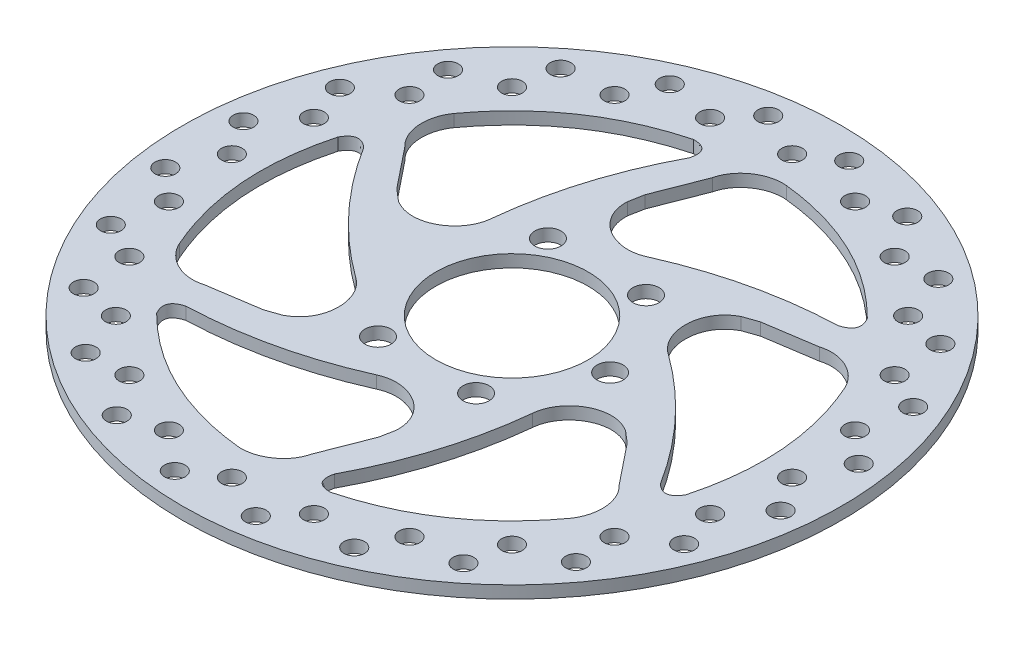
from build123d import *

# Parameters (mm, degrees)
SKETCH1_R           = 80
SKETCH1_R_2         = 2.5
SKETCH1_R_3         = 18.5
SKETCH1_R_4         = 3.175
BOSS_EXTRUDE1_DEPTH = 3


with BuildPart() as part:
    # Sketch1 → Boss-Extrude1 (new body)
    with BuildSketch(Plane(origin=(0, 0, 0), x_dir=(1, 0, 0), z_dir=(0, 1, 0))):
        Circle(SKETCH1_R)
        with Locations((0, 68)):
            Circle(SKETCH1_R_2, mode=Mode.SUBTRACT)
        with Locations((8.332202922, 73.529411765)):
            Circle(SKETCH1_R_2, mode=Mode.SUBTRACT)
        with Locations((17.599695067, 65.682956188)):
            Circle(SKETCH1_R_2, mode=Mode.SUBTRACT)
        with Locations((27.079102132, 68.867425011)):
            Circle(SKETCH1_R_2, mode=Mode.SUBTRACT)
        with Locations((34, 58.889727457)):
            Circle(SKETCH1_R_2, mode=Mode.SUBTRACT)
        with Locations((43.980605282, 59.512237052)):
            Circle(SKETCH1_R_2, mode=Mode.SUBTRACT)
        with Locations((48.083261121, 48.083261121)):
            Circle(SKETCH1_R_2, mode=Mode.SUBTRACT)
        with Locations((57.884902864, 46.101388487)):
            Circle(SKETCH1_R_2, mode=Mode.SUBTRACT)
        with Locations((58.889727457, 34)):
            Circle(SKETCH1_R_2, mode=Mode.SUBTRACT)
        with Locations((67.844439975, 29.548806482)):
            Circle(SKETCH1_R_2, mode=Mode.SUBTRACT)
        with Locations((65.682956188, 17.599695067)):
            Circle(SKETCH1_R_2, mode=Mode.SUBTRACT)
        with Locations((73.180490619, 10.982522147)):
            Circle(SKETCH1_R_2, mode=Mode.SUBTRACT)
        with Locations((68, 0)):
            Circle(SKETCH1_R_2, mode=Mode.SUBTRACT)
        with Locations((73.529411765, -8.332202922)):
            Circle(SKETCH1_R_2, mode=Mode.SUBTRACT)
        with Locations((65.682956188, -17.599695067)):
            Circle(SKETCH1_R_2, mode=Mode.SUBTRACT)
        with Locations((68.867425011, -27.079102132)):
            Circle(SKETCH1_R_2, mode=Mode.SUBTRACT)
        with Locations((58.889727457, -34)):
            Circle(SKETCH1_R_2, mode=Mode.SUBTRACT)
        with Locations((59.512237052, -43.980605282)):
            Circle(SKETCH1_R_2, mode=Mode.SUBTRACT)
        with Locations((48.083261121, -48.083261121)):
            Circle(SKETCH1_R_2, mode=Mode.SUBTRACT)
        with Locations((46.101388487, -57.884902864)):
            Circle(SKETCH1_R_2, mode=Mode.SUBTRACT)
        with Locations((34, -58.889727457)):
            Circle(SKETCH1_R_2, mode=Mode.SUBTRACT)
        with Locations((29.548806482, -67.844439975)):
            Circle(SKETCH1_R_2, mode=Mode.SUBTRACT)
        with Locations((17.599695067, -65.682956188)):
            Circle(SKETCH1_R_2, mode=Mode.SUBTRACT)
        with Locations((10.982522147, -73.180490619)):
            Circle(SKETCH1_R_2, mode=Mode.SUBTRACT)
        with Locations((0, -68)):
            Circle(SKETCH1_R_2, mode=Mode.SUBTRACT)
        with Locations((-8.332202922, -73.529411765)):
            Circle(SKETCH1_R_2, mode=Mode.SUBTRACT)
        with Locations((-17.599695067, -65.682956188)):
            Circle(SKETCH1_R_2, mode=Mode.SUBTRACT)
        with Locations((-27.079102132, -68.867425011)):
            Circle(SKETCH1_R_2, mode=Mode.SUBTRACT)
        with Locations((-34, -58.889727457)):
            Circle(SKETCH1_R_2, mode=Mode.SUBTRACT)
        with Locations((-43.980605282, -59.512237052)):
            Circle(SKETCH1_R_2, mode=Mode.SUBTRACT)
        with Locations((-48.083261121, -48.083261121)):
            Circle(SKETCH1_R_2, mode=Mode.SUBTRACT)
        with Locations((-57.884902864, -46.101388487)):
            Circle(SKETCH1_R_2, mode=Mode.SUBTRACT)
        with Locations((-58.889727457, -34)):
            Circle(SKETCH1_R_2, mode=Mode.SUBTRACT)
        with Locations((-67.844439975, -29.548806482)):
            Circle(SKETCH1_R_2, mode=Mode.SUBTRACT)
        with Locations((-65.682956188, -17.599695067)):
            Circle(SKETCH1_R_2, mode=Mode.SUBTRACT)
        with Locations((-73.180490619, -10.982522147)):
            Circle(SKETCH1_R_2, mode=Mode.SUBTRACT)
        with Locations((-68, 0)):
            Circle(SKETCH1_R_2, mode=Mode.SUBTRACT)
        with Locations((-73.529411765, 8.332202922)):
            Circle(SKETCH1_R_2, mode=Mode.SUBTRACT)
        with Locations((-65.682956188, 17.599695067)):
            Circle(SKETCH1_R_2, mode=Mode.SUBTRACT)
        with Locations((-68.867425011, 27.079102132)):
            Circle(SKETCH1_R_2, mode=Mode.SUBTRACT)
        with Locations((-58.889727457, 34)):
            Circle(SKETCH1_R_2, mode=Mode.SUBTRACT)
        with Locations((-59.512237052, 43.980605282)):
            Circle(SKETCH1_R_2, mode=Mode.SUBTRACT)
        with Locations((-48.083261121, 48.083261121)):
            Circle(SKETCH1_R_2, mode=Mode.SUBTRACT)
        with Locations((-46.101388487, 57.884902864)):
            Circle(SKETCH1_R_2, mode=Mode.SUBTRACT)
        with Locations((-34, 58.889727457)):
            Circle(SKETCH1_R_2, mode=Mode.SUBTRACT)
        with Locations((-29.548806482, 67.844439975)):
            Circle(SKETCH1_R_2, mode=Mode.SUBTRACT)
        with Locations((-17.599695067, 65.682956188)):
            Circle(SKETCH1_R_2, mode=Mode.SUBTRACT)
        with Locations((-10.982522147, 73.180490619)):
            Circle(SKETCH1_R_2, mode=Mode.SUBTRACT)
        Circle(SKETCH1_R_3, mode=Mode.SUBTRACT)
        with Locations((-11.90625, 20.622229928)):
            Circle(SKETCH1_R_4, mode=Mode.SUBTRACT)
        with Locations((11.90625, 20.622229928)):
            Circle(SKETCH1_R_4, mode=Mode.SUBTRACT)
        with Locations((23.8125, 0)):
            Circle(SKETCH1_R_4, mode=Mode.SUBTRACT)
        with Locations((11.90625, -20.622229928)):
            Circle(SKETCH1_R_4, mode=Mode.SUBTRACT)
        with Locations((-11.90625, -20.622229928)):
            Circle(SKETCH1_R_4, mode=Mode.SUBTRACT)
        with BuildLine():
            Line((-9.315993321, 41.634868421), (-4.742741297, 53.355893883))
            add(Edge.make_bspline(
                [(-4.742741297, 53.355893883), (-3.617179994, 58.141088286), (1.364432068, 61.178922208), (5.953223317, 60.708806051)],
                knots=[0, 0, 0, 0, 1, 1, 1, 1], degree=3))
            add(Edge.make_bspline(
                [(5.953223317, 60.708806051), (27.994120627, 58.322754235), (43.642459298, 42.618490663)],
                knots=[0, 0, 0, 1, 1, 1], degree=2))
            add(Edge.make_bspline(
                [(41.595098769, 37.524132931), (45.940667236, 38.736285254), (43.642459298, 42.618490663)],
                knots=[0, 0, 0, 1, 1, 1], degree=2))
            add(Edge.make_bspline(
                [(4.081342093, 28.870780607), (21.997498313, 36.842130391), (41.595098769, 37.524132931)],
                knots=[0, 0, 0, 1, 1, 1], degree=2))
            add(Edge.make_bspline(
                [(4.081342093, 28.870780607), (-1.887276933, 26.023157642), (-10.304245695, 30.434997813), (-10, 38)],
                knots=[0, 0, 0, 0, 1, 1, 1, 1], degree=3))
            Line((-10, 38), (-9.315993321, 41.634868421))
        make_face(mode=Mode.SUBTRACT)
        with BuildLine():
            Line((31.398857075, 28.885321088), (43.836188896, 30.785281388))
            add(Edge.make_bspline(
                [(43.836188896, 30.785281388), (48.543069462, 32.203113908), (53.664716842, 29.407828271), (55.551979932, 25.198760399)],
                knots=[0, 0, 0, 0, 1, 1, 1, 1], degree=3))
            add(Edge.make_bspline(
                [(55.551979932, 25.198760399), (64.5060471, 4.917757498), (58.729925234, -16.486233105)],
                knots=[0, 0, 0, 1, 1, 1], degree=2))
            add(Edge.make_bspline(
                [(53.294401758, -17.260345741), (56.516940696, -20.417642266), (58.729925234, -16.486233105)],
                knots=[0, 0, 0, 1, 1, 1], degree=2))
            add(Edge.make_bspline(
                [(27.043500479, 10.90084437), (42.904970004, -0.629327163), (53.294401758, -17.260345741)],
                knots=[0, 0, 0, 1, 1, 1], degree=2))
            add(Edge.make_bspline(
                [(27.043500479, 10.90084437), (21.593077138, 14.646008589), (21.205358423, 24.141237446), (27.908965344, 27.660254038)],
                knots=[0, 0, 0, 0, 1, 1, 1, 1], degree=3))
            Line((27.908965344, 27.660254038), (31.398857075, 28.885321088))
        make_face(mode=Mode.SUBTRACT)
        with BuildLine():
            Line((40.714850396, -12.749547333), (48.578930193, -22.570612494))
            add(Edge.make_bspline(
                [(48.578930193, -22.570612494), (52.160249457, -25.937974378), (52.300284774, -31.771093936), (49.598756615, -35.510045652)],
                knots=[0, 0, 0, 0, 1, 1, 1, 1], degree=3))
            add(Edge.make_bspline(
                [(49.598756615, -35.510045652), (36.511926472, -53.404996737), (15.087465936, -59.104723768)],
                knots=[0, 0, 0, 1, 1, 1], degree=2))
            add(Edge.make_bspline(
                [(11.699302989, -54.784478672), (10.576273461, -59.15392752), (15.087465936, -59.104723768)],
                knots=[0, 0, 0, 1, 1, 1], degree=2))
            add(Edge.make_bspline(
                [(22.962158387, -17.969936237), (20.907471691, -37.471457554), (11.699302989, -54.784478672)],
                knots=[0, 0, 0, 1, 1, 1], degree=2))
            add(Edge.make_bspline(
                [(22.962158387, -17.969936237), (23.480354071, -11.377149053), (31.509604118, -6.293760367), (37.908965344, -10.339745962)],
                knots=[0, 0, 0, 0, 1, 1, 1, 1], degree=3))
            Line((37.908965344, -10.339745962), (40.714850396, -12.749547333))
        make_face(mode=Mode.SUBTRACT)
        with BuildLine():
            Line((9.315993321, -41.634868421), (4.742741297, -53.355893883))
            add(Edge.make_bspline(
                [(4.742741297, -53.355893883), (3.617179994, -58.141088286), (-1.364432068, -61.178922208), (-5.953223317, -60.708806051)],
                knots=[0, 0, 0, 0, 1, 1, 1, 1], degree=3))
            add(Edge.make_bspline(
                [(-5.953223317, -60.708806051), (-27.994120627, -58.322754235), (-43.642459298, -42.618490663)],
                knots=[0, 0, 0, 1, 1, 1], degree=2))
            add(Edge.make_bspline(
                [(-41.595098769, -37.524132931), (-45.940667236, -38.736285254), (-43.642459298, -42.618490663)],
                knots=[0, 0, 0, 1, 1, 1], degree=2))
            add(Edge.make_bspline(
                [(-4.081342093, -28.870780607), (-21.997498313, -36.842130391), (-41.595098769, -37.524132931)],
                knots=[0, 0, 0, 1, 1, 1], degree=2))
            add(Edge.make_bspline(
                [(-4.081342093, -28.870780607), (1.887276933, -26.023157642), (10.304245695, -30.434997813), (10, -38)],
                knots=[0, 0, 0, 0, 1, 1, 1, 1], degree=3))
            Line((10, -38), (9.315993321, -41.634868421))
        make_face(mode=Mode.SUBTRACT)
        with BuildLine():
            Line((-31.398857075, -28.885321088), (-43.836188896, -30.785281388))
            add(Edge.make_bspline(
                [(-43.836188896, -30.785281388), (-48.543069462, -32.203113908), (-53.664716842, -29.407828271), (-55.551979932, -25.198760399)],
                knots=[0, 0, 0, 0, 1, 1, 1, 1], degree=3))
            add(Edge.make_bspline(
                [(-55.551979932, -25.198760399), (-64.5060471, -4.917757498), (-58.729925234, 16.486233105)],
                knots=[0, 0, 0, 1, 1, 1], degree=2))
            add(Edge.make_bspline(
                [(-53.294401758, 17.260345741), (-56.516940696, 20.417642266), (-58.729925234, 16.486233105)],
                knots=[0, 0, 0, 1, 1, 1], degree=2))
            add(Edge.make_bspline(
                [(-27.043500479, -10.90084437), (-42.904970004, 0.629327163), (-53.294401758, 17.260345741)],
                knots=[0, 0, 0, 1, 1, 1], degree=2))
            add(Edge.make_bspline(
                [(-27.043500479, -10.90084437), (-21.593077138, -14.646008589), (-21.205358423, -24.141237446), (-27.908965344, -27.660254038)],
                knots=[0, 0, 0, 0, 1, 1, 1, 1], degree=3))
            Line((-27.908965344, -27.660254038), (-31.398857075, -28.885321088))
        make_face(mode=Mode.SUBTRACT)
        with BuildLine():
            Line((-40.714850396, 12.749547333), (-48.578930193, 22.570612494))
            add(Edge.make_bspline(
                [(-48.578930193, 22.570612494), (-52.160249457, 25.937974378), (-52.300284774, 31.771093936), (-49.598756615, 35.510045652)],
                knots=[0, 0, 0, 0, 1, 1, 1, 1], degree=3))
            add(Edge.make_bspline(
                [(-49.598756615, 35.510045652), (-36.511926472, 53.404996737), (-15.087465936, 59.104723768)],
                knots=[0, 0, 0, 1, 1, 1], degree=2))
            add(Edge.make_bspline(
                [(-11.699302989, 54.784478672), (-10.576273461, 59.15392752), (-15.087465936, 59.104723768)],
                knots=[0, 0, 0, 1, 1, 1], degree=2))
            add(Edge.make_bspline(
                [(-22.962158387, 17.969936237), (-20.907471691, 37.471457554), (-11.699302989, 54.784478672)],
                knots=[0, 0, 0, 1, 1, 1], degree=2))
            add(Edge.make_bspline(
                [(-22.962158387, 17.969936237), (-23.480354071, 11.377149053), (-31.509604118, 6.293760367), (-37.908965344, 10.339745962)],
                knots=[0, 0, 0, 0, 1, 1, 1, 1], degree=3))
            Line((-37.908965344, 10.339745962), (-40.714850396, 12.749547333))
        make_face(mode=Mode.SUBTRACT)
    extrude(amount=BOSS_EXTRUDE1_DEPTH)


solid = part.part
